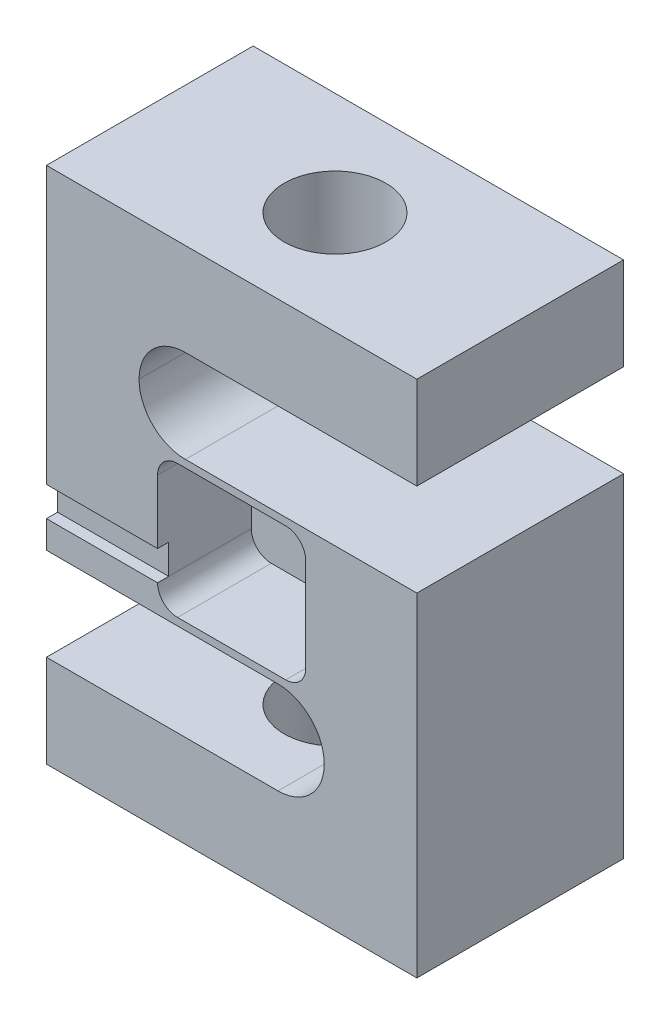
from build123d import *

# Parameters (mm, degrees)
BOSS_EXTRUDE1_DEPTH         = 17.7165
FILLET1_R                   = 7.9375
F_3_4_16_TAPPED_HOLE1_D     = 17.4625
F_3_4_16_TAPPED_HOLE1_DEPTH = 15.875
F_3_4_16_TAPPED_HOLE2_D     = 17.4625
F_3_4_16_TAPPED_HOLE2_DEPTH = 15.875
SKETCH8_W                   = 25.4
SKETCH8_H                   = 22.86
CUT_EXTRUDE1_DEPTH          = 16.0655
FILLET2_R                   = 3.429
FILLET2_OF_MIRROR1_R        = 3.429
SKETCH10_R                  = 1.27
BOSS_EXTRUDE2_DEPTH         = 0.254
SKETCH15_W                  = 19.05
SKETCH15_H                  = 5.08
CUT_EXTRUDE2_DEPTH          = 1.905


with BuildPart() as part:
    # Sketch1 → Boss-Extrude1 (new, symmetric)
    with BuildSketch(Plane.XY):
        Polygon((47.625, 0), (0, 0), (0, 15.875), (47.625, 15.875), (47.625, 31.75), (-15.875, 31.75), (-15.875, -25.4), (31.75, -25.4), (31.75, -41.275), (-15.875, -41.275), (-15.875, -57.15), (47.625, -57.15), align=None)
    extrude(amount=BOSS_EXTRUDE1_DEPTH, both=True)

    # Fillet1
    fillet1_edges = [part.edges().sort_by_distance(p)[0] for p in [
        (31.75, -41.275, 0),
        (31.75, -25.4, 0),
        (0, 15.875, 0),
        (0, 0, 0),
    ]]
    fillet(fillet1_edges, radius=FILLET1_R - 0.0001)  # a hair under: the kernel refuses the full size

    # 3/4-16 Tapped Hole1
    with Locations(Plane.XZ.offset(57.15)):
        with Locations((15.875, 0)):
            Hole(F_3_4_16_TAPPED_HOLE1_D / 2, depth=F_3_4_16_TAPPED_HOLE1_DEPTH)

    # 3/4-16 Tapped Hole2
    with Locations(Plane(origin=(0, 31.75, 0), x_dir=(-1, 0, 0), z_dir=(0, 1, 0))):
        with Locations((-15.875, 0)):
            Hole(F_3_4_16_TAPPED_HOLE2_D / 2, depth=F_3_4_16_TAPPED_HOLE2_DEPTH)

    # Sketch8 → Cut-Extrude1 (cut)
    with BuildSketch(Plane.XY.offset(17.7165)):
        with Locations((15.875, -12.7)):
            Rectangle(SKETCH8_W, SKETCH8_H)
    cut_extrude1 = extrude(amount=-CUT_EXTRUDE1_DEPTH, mode=Mode.SUBTRACT)

    # Fillet2
    fillet2_edges = [part.edges().sort_by_distance(p)[0] for p in [
        (28.575, -1.27, 9.68375),
        (28.575, -24.13, 9.68375),
        (3.175, -24.13, 9.68375),
        (3.175, -1.27, 9.68375),
    ]]
    fillet(fillet2_edges, radius=FILLET2_R)

    # Mirror1: Cut-Extrude1 across plane
    add(cut_extrude1.mirror(Plane.XY), mode=Mode.SUBTRACT)

    # Fillet2 of Mirror1
    fillet2_of_mirror1_edges = [part.edges().sort_by_distance(p)[0] for p in [
        (28.575, -1.27, -9.68375),
        (28.575, -24.13, -9.68375),
        (3.175, -24.13, -9.68375),
        (3.175, -1.27, -9.68375),
    ]]
    fillet(fillet2_of_mirror1_edges, radius=FILLET2_OF_MIRROR1_R)

    # Sketch10 → Boss-Extrude2 (add)
    with BuildSketch(Plane.XY.offset(1.651)):
        with Locations(Location((15.875, -12.7, 0), (0, 0, 180))):
            Circle(SKETCH10_R)
    boss_extrude2 = extrude(amount=BOSS_EXTRUDE2_DEPTH)

    # Mirror2: Boss-Extrude2 across plane
    add(boss_extrude2.mirror(Plane.XY))

    # Sketch15 → Cut-Extrude2 (cut)
    with BuildSketch(Plane.XY.offset(17.7165)):
        with Locations((-6.35, -18.161)):
            Rectangle(SKETCH15_W, SKETCH15_H)
    extrude(amount=-CUT_EXTRUDE2_DEPTH, mode=Mode.SUBTRACT)


solid = part.part
